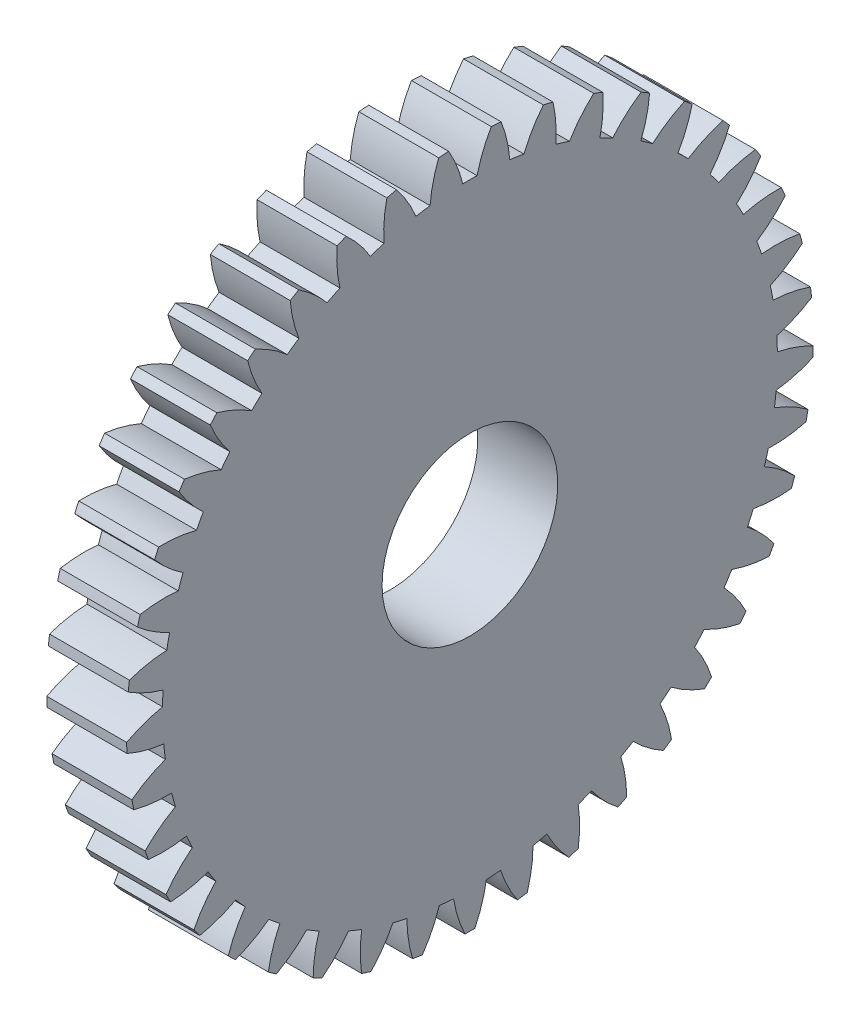
from build123d import *

# Parameters (mm, degrees)
SKETCH1_R           = 5.5
BOSS_EXTRUDE1_DEPTH = 2.5


with BuildPart() as part:
    # Sketch1 → Boss-Extrude1 (new, symmetric)
    with BuildSketch(Plane(origin=(0, 0, 0), x_dir=(0, 0, -1), z_dir=(1, 0, 0))):
        with BuildLine():
            ThreePointArc((-21.391404293, 2.158198868), (-20.337604136, 1.591457152), (-19.212545081, 1.184108323))
            ThreePointArc((-19.212545081, 1.184108323), (-19.234874719, 0.737289321), (-19.246814261, 0.290072057))
            ThreePointArc((-19.246814261, 0.290072057), (-20.399754417, -0.029959099), (-21.493846171, -0.514370267))
            ThreePointArc((-21.493846171, -0.514370267), (-21.484222893, -0.823508774), (-21.470153613, -1.132476862))
            ThreePointArc((-21.470153613, -1.132476862), (-20.342190829, -1.531714765), (-19.168135482, -1.762550179))
            ThreePointArc((-19.168135482, -1.762550179), (-19.121996826, -2.207541255), (-19.065529046, -2.651339885))
            ThreePointArc((-19.065529046, -2.651339885), (-20.156104706, -3.143615901), (-21.16342915, -3.789362299))
            ThreePointArc((-21.16342915, -3.789362299), (-21.10672888, -4.093408847), (-21.045660729, -4.396608295))
            ThreePointArc((-21.045660729, -4.396608295), (-19.86997381, -4.618984587), (-18.674441034, -4.667895999))
            ThreePointArc((-18.674441034, -4.667895999), (-18.560915534, -5.100628936), (-18.43736399, -5.530606667))
            ThreePointArc((-18.43736399, -5.530606667), (-19.440012983, -6.183589011), (-20.336959286, -6.97553489))
            ThreePointArc((-20.336959286, -6.97553489), (-20.234511032, -7.267362886), (-20.127875394, -7.557686955))
            ThreePointArc((-20.127875394, -7.557686955), (-18.932021447, -7.597989325), (-17.743033516, -7.463830293))
            ThreePointArc((-17.743033516, -7.463830293), (-17.564782114, -7.874162197), (-17.377042748, -8.280240717))
            ThreePointArc((-17.377042748, -8.280240717), (-18.268263833, -9.078624036), (-19.033808334, -9.998206855))
            ThreePointArc((-19.033808334, -9.998206855), (-18.888013395, -10.270976098), (-18.738309721, -10.541619838))
            ThreePointArc((-18.738309721, -10.541619838), (-17.550318547, -10.398903632), (-16.395744331, -10.084818731))
            ThreePointArc((-16.395744331, -10.084818731), (-16.156945088, -10.46313177), (-15.909418353, -10.835792942))
            ThreePointArc((-15.909418353, -10.835792942), (-16.668322062, -11.760863807), (-17.284521046, -12.786529326))
            ThreePointArc((-17.284521046, -12.786529326), (-17.098796732, -13.033846336), (-16.909533949, -13.278466087))
            ThreePointArc((-16.909533949, -13.278466087), (-15.757251055, -12.956076452), (-14.664152794, -12.469427566))
            ThreePointArc((-14.664152794, -12.469427566), (-14.370402963, -12.806854402), (-14.068890675, -13.137363365))
            ThreePointArc((-14.068890675, -13.137363365), (-14.677688949, -14.167438899), (-15.130099235, -15.275146387))
            ThreePointArc((-15.130099235, -15.275146387), (-14.908798767, -15.491214262), (-14.684413033, -15.704076346))
            ThreePointArc((-14.684413033, -15.704076346), (-13.594846953, -15.209569822), (-12.588845946, -14.561763587))
            ThreePointArc((-12.588845946, -14.561763587), (-12.247030772, -14.850395222), (-11.898600124, -15.131005125))
            ThreePointArc((-11.898600124, -15.131005125), (-12.343023247, -16.241941231), (-12.621040722, -17.405726963))
            ThreePointArc((-12.621040722, -17.405726963), (-12.369351195, -17.585481256), (-12.115101922, -17.761596365))
            ThreePointArc((-12.115101922, -17.761596365), (-11.113791161, -17.106563765), (-10.218467217, -16.312784211))
            ThreePointArc((-10.218467217, -16.312784211), (-9.836598561, -16.545855365), (-9.449416472, -16.769988949))
            ThreePointArc((-9.449416472, -16.769988949), (-9.719047542, -17.935746227), (-9.816155711, -19.128332051))
            ThreePointArc((-9.816155711, -19.128332051), (-9.539976514, -19.267559475), (-9.26182309, -19.402799619))
            ThreePointArc((-9.26182309, -19.402799619), (-8.372237525, -18.602594353), (-7.608576279, -17.681447))
            ThreePointArc((-7.608576279, -17.681447), (-7.195604816, -17.853494681), (-6.778746506, -18.015898446))
            ThreePointArc((-6.778746506, -18.015898446), (-6.8672656, -19.209152532), (-6.78118833, -20.402585249))
            ThreePointArc((-6.78118833, -20.402585249), (-6.48699287, -20.498022429), (-6.191454975, -20.589217695))
            ThreePointArc((-6.191454975, -20.589217695), (-5.434445736, -19.662595896), (-4.82034676, -18.635671657))
            ThreePointArc((-4.82034676, -18.635671657), (-4.385952193, -18.742663214), (-3.949188467, -18.839530553))
            ThreePointArc((-3.949188467, -18.839530553), (-3.854520773, -20.032312584), (-3.587275642, -21.198619141))
            ThreePointArc((-3.587275642, -21.198619141), (-3.281959611, -21.248029111), (-2.975964402, -21.293041959))
            ThreePointArc((-2.975964402, -21.293041959), (-2.369275146, -20.261722857), (-1.9191324, -19.153091965))
            ThreePointArc((-1.9191324, -19.153091965), (-1.473496568, -19.192519607), (-1.027064798, -19.221580031))
            ThreePointArc((-1.027064798, -19.221580031), (-0.751429246, -20.385932206), (-0.309280253, -21.497775367))
            ThreePointArc((-0.309280253, -21.497775367), (0, -21.5), (0.309280253, -21.497775367))
            ThreePointArc((0.309280253, -21.497775367), (0.751429246, -20.385932206), (1.027064798, -19.221580031))
            ThreePointArc((1.027064798, -19.221580031), (1.473496568, -19.192519607), (1.9191324, -19.153091965))
            ThreePointArc((1.9191324, -19.153091965), (2.369275146, -20.261722857), (2.975964402, -21.293041959))
            ThreePointArc((2.975964402, -21.293041959), (3.281959611, -21.248029111), (3.587275642, -21.198619141))
            ThreePointArc((3.587275642, -21.198619141), (3.854520773, -20.032312584), (3.949188467, -18.839530553))
            ThreePointArc((3.949188467, -18.839530553), (4.385952193, -18.742663214), (4.82034676, -18.635671657))
            ThreePointArc((4.82034676, -18.635671657), (5.434445736, -19.662595896), (6.191454975, -20.589217695))
            ThreePointArc((6.191454975, -20.589217695), (6.48699287, -20.498022429), (6.78118833, -20.402585249))
            ThreePointArc((6.78118833, -20.402585249), (6.8672656, -19.209152532), (6.778746506, -18.015898446))
            ThreePointArc((6.778746506, -18.015898446), (7.195604816, -17.853494681), (7.608576279, -17.681447))
            ThreePointArc((7.608576279, -17.681447), (8.372237525, -18.602594353), (9.26182309, -19.402799619))
            ThreePointArc((9.26182309, -19.402799619), (9.539976514, -19.267559475), (9.816155711, -19.128332051))
            ThreePointArc((9.816155711, -19.128332051), (9.719047542, -17.935746227), (9.449416472, -16.769988949))
            ThreePointArc((9.449416472, -16.769988949), (9.836598561, -16.545855365), (10.218467217, -16.312784211))
            ThreePointArc((10.218467217, -16.312784211), (11.113791161, -17.106563765), (12.115101922, -17.761596365))
            ThreePointArc((12.115101922, -17.761596365), (12.369351195, -17.585481256), (12.621040722, -17.405726963))
            ThreePointArc((12.621040722, -17.405726963), (12.343023247, -16.241941231), (11.898600124, -15.131005125))
            ThreePointArc((11.898600124, -15.131005125), (12.247030772, -14.850395222), (12.588845946, -14.561763587))
            ThreePointArc((12.588845946, -14.561763587), (13.594846953, -15.209569822), (14.684413033, -15.704076346))
            ThreePointArc((14.684413033, -15.704076346), (14.908798767, -15.491214262), (15.130099235, -15.275146387))
            ThreePointArc((15.130099235, -15.275146387), (14.677688949, -14.167438899), (14.068890675, -13.137363365))
            ThreePointArc((14.068890675, -13.137363365), (14.370402963, -12.806854402), (14.664152794, -12.469427566))
            ThreePointArc((14.664152794, -12.469427566), (15.757251055, -12.956076452), (16.909533949, -13.278466087))
            ThreePointArc((16.909533949, -13.278466087), (17.098796732, -13.033846336), (17.284521046, -12.786529326))
            ThreePointArc((17.284521046, -12.786529326), (16.668322062, -11.760863807), (15.909418353, -10.835792942))
            ThreePointArc((15.909418353, -10.835792942), (16.156945088, -10.46313177), (16.395744331, -10.084818731))
            ThreePointArc((16.395744331, -10.084818731), (17.550318547, -10.398903632), (18.738309721, -10.541619838))
            ThreePointArc((18.738309721, -10.541619838), (18.888013395, -10.270976098), (19.033808334, -9.998206855))
            ThreePointArc((19.033808334, -9.998206855), (18.268263833, -9.078624036), (17.377042748, -8.280240717))
            ThreePointArc((17.377042748, -8.280240717), (17.564782114, -7.874162197), (17.743033516, -7.463830293))
            ThreePointArc((17.743033516, -7.463830293), (18.932021447, -7.597989325), (20.127875394, -7.557686955))
            ThreePointArc((20.127875394, -7.557686955), (20.234511032, -7.267362886), (20.336959286, -6.97553489))
            ThreePointArc((20.336959286, -6.97553489), (19.440012983, -6.183589011), (18.43736399, -5.530606667))
            ThreePointArc((18.43736399, -5.530606667), (18.560915534, -5.100628936), (18.674441034, -4.667895999))
            ThreePointArc((18.674441034, -4.667895999), (19.86997381, -4.618984587), (21.045660729, -4.396608295))
            ThreePointArc((21.045660729, -4.396608295), (21.10672888, -4.093408847), (21.16342915, -3.789362299))
            ThreePointArc((21.16342915, -3.789362299), (20.156104706, -3.143615901), (19.065529046, -2.651339885))
            ThreePointArc((19.065529046, -2.651339885), (19.121996826, -2.207541255), (19.168135482, -1.762550179))
            ThreePointArc((19.168135482, -1.762550179), (20.342190829, -1.531714765), (21.470153613, -1.132476862))
            ThreePointArc((21.470153613, -1.132476862), (21.484222893, -0.823508774), (21.493846171, -0.514370267))
            ThreePointArc((21.493846171, -0.514370267), (20.399754417, -0.029959099), (19.246814261, 0.290072057))
            ThreePointArc((19.246814261, 0.290072057), (19.234874719, 0.737289321), (19.212545081, 1.184108323))
            ThreePointArc((19.212545081, 1.184108323), (20.337604136, 1.591457152), (21.391404293, 2.158198868))
            ThreePointArc((21.391404293, 2.158198868), (21.35814493, 2.465693646), (21.320465656, 2.772678167))
            ThreePointArc((21.320465656, 2.772678167), (20.165251176, 3.084399919), (18.976970463, 3.224684956))
            ThreePointArc((18.976970463, 3.224684956), (18.896903452, 3.66483846), (18.806628906, 4.10301233))
            ThreePointArc((18.806628906, 4.10301233), (19.856321239, 4.677326663), (20.811258588, 5.398288245))
            ThreePointArc((20.811258588, 5.398288245), (20.731450152, 5.697102297), (20.647351496, 5.994737376))
            ThreePointArc((20.647351496, 5.994737376), (19.458091538, 6.126463217), (18.26232256, 6.083713973))
            ThreePointArc((18.26232256, 6.083713973), (18.116004784, 6.506486892), (17.95990129, 6.925745205))
            ThreePointArc((17.95990129, 6.925745205), (18.909623001, 7.653563601), (19.74331462, 8.511846322))
            ThreePointArc((19.74331462, 8.511846322), (19.618827754, 8.794975699), (19.490280917, 9.076285021))
            ThreePointArc((19.490280917, 9.076285021), (18.294850726, 9.02492741), (17.119621296, 8.80014589))
            ThreePointArc((17.119621296, 8.80014589), (16.910482318, 9.195628787), (16.69220881, 9.586144483))
            ThreePointArc((16.69220881, 9.586144483), (17.519699228, 10.450407495), (18.212604091, 11.425893935))
            ThreePointArc((18.212604091, 11.425893935), (18.046356662, 11.686702325), (17.876374672, 11.945092238))
            ThreePointArc((17.876374672, 11.945092238), (16.702794119, 11.711854953), (15.575650618, 11.310309846))
            ThreePointArc((15.575650618, 11.310309846), (15.308592479, 11.669232936), (15.033265103, 12.021852659))
            ThreePointArc((15.033265103, 12.021852659), (15.719128554, 13.002302694), (16.255005559, 14.072128279))
            ThreePointArc((16.255005559, 14.072128279), (16.050894265, 14.304502554), (15.843461357, 14.533916617))
            ThreePointArc((15.843461357, 14.533916617), (14.719238175, 14.124266543), (13.666599891, 13.555369726))
            ThreePointArc((13.666599891, 13.555369726), (13.347882208, 13.869320155), (13.021954403, 14.175778798))
            ThreePointArc((13.021954403, 14.175778798), (13.550114829, 15.249434939), (13.916403473, 16.388523862))
            ThreePointArc((13.916403473, 16.388523862), (13.67921251, 16.587017366), (13.439190735, 16.782078309))
            ThreePointArc((13.439190735, 16.782078309), (12.390675763, 16.205617297), (11.437215646, 15.482703229))
            ThreePointArc((11.437215646, 15.482703229), (11.074308891, 15.744322265), (10.705420129, 15.997436697))
            ThreePointArc((10.705420129, 15.997436697), (11.063497897, 17.139133354), (11.251612685, 18.320786337))
            ThreePointArc((11.251612685, 18.320786337), (10.986901608, 18.48074655), (10.719916873, 18.63688231))
            ThreePointArc((10.719916873, 18.63688231), (9.771686414, 17.907122116), (8.93975276, 17.04713529))
            ThreePointArc((8.93975276, 17.04713529), (8.541163159, 17.250290806), (8.137959881, 17.444128238))
            ThreePointArc((8.137959881, 17.444128238), (8.317561952, 18.627105009), (8.323093632, 19.823625107))
            ThreePointArc((8.323093632, 19.823625107), (8.037067045, 19.941302699), (7.749377246, 20.054853585))
            ThreePointArc((7.749377246, 20.054853585), (6.923657017, 19.18889917), (6.232749646, 18.211996948))
            ThreePointArc((6.232749646, 18.211996948), (5.807819802, 18.351927151), (5.37975275, 18.481944198))
            ThreePointArc((5.37975275, 18.481944198), (5.376669404, 19.678473111), (5.199488318, 20.861814907))
            ThreePointArc((5.199488318, 20.861814907), (4.898850441, 20.934451613), (4.597198784, 21.002756089))
            ThreePointArc((4.597198784, 21.002756089), (3.913342967, 20.020904691), (3.379656163, 18.949984834))
            ThreePointArc((3.379656163, 18.949984834), (2.938346072, 19.023409877), (2.495448775, 19.086559051))
            ThreePointArc((2.495448775, 19.086559051), (2.309752282, 20.268594481), (1.954011405, 21.411021448))
            ThreePointArc((1.954011405, 21.411021448), (1.645808936, 21.436914725), (1.337265878, 21.458371792))
            ThreePointArc((1.337265878, 21.458371792), (0.811303476, 20.383637176), (0.447346404, 19.243801137))
            ThreePointArc((0.447346404, 19.243801137), (0, 19.249), (-0.447346404, 19.243801137))
            ThreePointArc((-0.447346404, 19.243801137), (-0.811303476, 20.383637176), (-1.337265878, 21.458371792))
            ThreePointArc((-1.337265878, 21.458371792), (-1.645808936, 21.436914725), (-1.954011405, 21.411021448))
            ThreePointArc((-1.954011405, 21.411021448), (-2.309752282, 20.268594481), (-2.495448775, 19.086559051))
            ThreePointArc((-2.495448775, 19.086559051), (-2.938346072, 19.023409877), (-3.379656163, 18.949984834))
            ThreePointArc((-3.379656163, 18.949984834), (-3.913342967, 20.020904691), (-4.597198784, 21.002756089))
            ThreePointArc((-4.597198784, 21.002756089), (-4.898850441, 20.934451613), (-5.199488318, 20.861814907))
            ThreePointArc((-5.199488318, 20.861814907), (-5.376669404, 19.678473111), (-5.37975275, 18.481944198))
            ThreePointArc((-5.37975275, 18.481944198), (-5.807819802, 18.351927151), (-6.232749646, 18.211996948))
            ThreePointArc((-6.232749646, 18.211996948), (-6.923657017, 19.18889917), (-7.749377246, 20.054853585))
            ThreePointArc((-7.749377246, 20.054853585), (-8.037067045, 19.941302699), (-8.323093632, 19.823625107))
            ThreePointArc((-8.323093632, 19.823625107), (-8.317561952, 18.627105009), (-8.137959881, 17.444128238))
            ThreePointArc((-8.137959881, 17.444128238), (-8.541163159, 17.250290806), (-8.93975276, 17.04713529))
            ThreePointArc((-8.93975276, 17.04713529), (-9.771686414, 17.907122116), (-10.719916873, 18.63688231))
            ThreePointArc((-10.719916873, 18.63688231), (-10.986901608, 18.48074655), (-11.251612685, 18.320786337))
            ThreePointArc((-11.251612685, 18.320786337), (-11.063497897, 17.139133354), (-10.705420129, 15.997436697))
            ThreePointArc((-10.705420129, 15.997436697), (-11.074308891, 15.744322265), (-11.437215646, 15.482703229))
            ThreePointArc((-11.437215646, 15.482703229), (-12.390675763, 16.205617297), (-13.439190735, 16.782078309))
            ThreePointArc((-13.439190735, 16.782078309), (-13.67921251, 16.587017366), (-13.916403473, 16.388523862))
            ThreePointArc((-13.916403473, 16.388523862), (-13.550114829, 15.249434939), (-13.021954403, 14.175778798))
            ThreePointArc((-13.021954403, 14.175778798), (-13.347882208, 13.869320155), (-13.666599891, 13.555369726))
            ThreePointArc((-13.666599891, 13.555369726), (-14.719238175, 14.124266543), (-15.843461357, 14.533916617))
            ThreePointArc((-15.843461357, 14.533916617), (-16.050894265, 14.304502554), (-16.255005559, 14.072128279))
            ThreePointArc((-16.255005559, 14.072128279), (-15.719128554, 13.002302694), (-15.033265103, 12.021852659))
            ThreePointArc((-15.033265103, 12.021852659), (-15.308592479, 11.669232936), (-15.575650618, 11.310309846))
            ThreePointArc((-15.575650618, 11.310309846), (-16.702794119, 11.711854953), (-17.876374672, 11.945092238))
            ThreePointArc((-17.876374672, 11.945092238), (-18.046356662, 11.686702325), (-18.212604091, 11.425893935))
            ThreePointArc((-18.212604091, 11.425893935), (-17.519699228, 10.450407495), (-16.69220881, 9.586144483))
            ThreePointArc((-16.69220881, 9.586144483), (-16.910482318, 9.195628787), (-17.119621296, 8.80014589))
            ThreePointArc((-17.119621296, 8.80014589), (-18.294850726, 9.02492741), (-19.490280917, 9.076285021))
            ThreePointArc((-19.490280917, 9.076285021), (-19.618827754, 8.794975699), (-19.74331462, 8.511846322))
            ThreePointArc((-19.74331462, 8.511846322), (-18.909623001, 7.653563601), (-17.95990129, 6.925745205))
            ThreePointArc((-17.95990129, 6.925745205), (-18.116004784, 6.506486892), (-18.26232256, 6.083713973))
            ThreePointArc((-18.26232256, 6.083713973), (-19.458091538, 6.126463217), (-20.647351496, 5.994737376))
            ThreePointArc((-20.647351496, 5.994737376), (-20.731450152, 5.697102297), (-20.811258588, 5.398288245))
            ThreePointArc((-20.811258588, 5.398288245), (-19.856321239, 4.677326663), (-18.806628906, 4.10301233))
            ThreePointArc((-18.806628906, 4.10301233), (-18.896903452, 3.66483846), (-18.976970463, 3.224684956))
            ThreePointArc((-18.976970463, 3.224684956), (-20.165251176, 3.084399919), (-21.320465656, 2.772678167))
            ThreePointArc((-21.320465656, 2.772678167), (-21.35814493, 2.465693646), (-21.391404293, 2.158198868))
        make_face()
        Circle(SKETCH1_R, mode=Mode.SUBTRACT)
    extrude(amount=BOSS_EXTRUDE1_DEPTH, both=True)


solid = part.part
